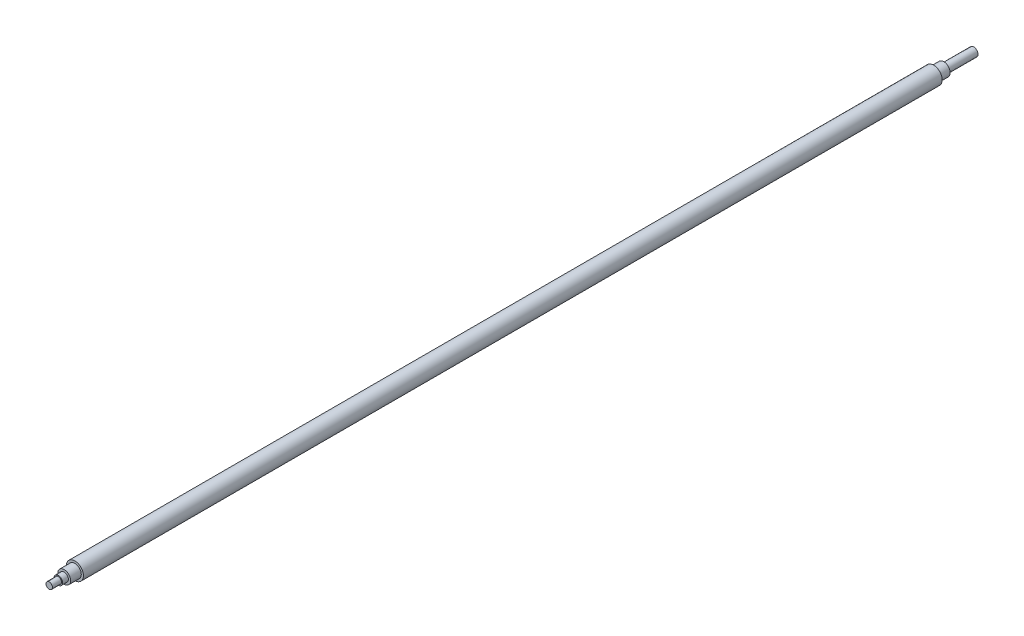
from build123d import *


with BuildPart() as part:
    # Schizzo2 → Rivoluzione2 (revolve)
    with BuildSketch(Plane(origin=(0, 0, 0), x_dir=(0, 0, -1), z_dir=(1, 0, 0))):
        Polygon((0, 0), (0, 3), (8.5, 3), (8.5, 4), (14, 4), (14, 6), (24, 6), (24, 8), (827, 8), (827, 6), (836.5, 6), (836.5, 4), (864.5, 4), (864.5, 0), align=None)
    revolve(axis=Axis((0, 0, 0), (0, 0, -1)))


solid = part.part
